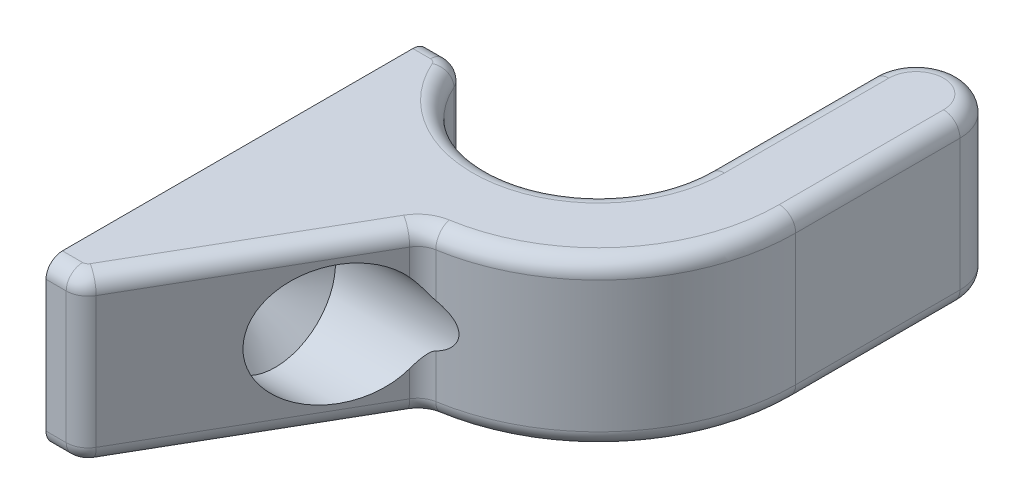
from build123d import *

# Parameters (mm, degrees)
BOSS_EXTRU_1_DEPTH      = 7.5
CONG_1_R                = 2
ESQUISSE2_R             = 2
ENL_V_MAT_EXTRU_1_DEPTH = 3
ESQUISSE3_R             = 5.5
ENL_V_MAT_EXTRU_2_DEPTH = 51.709008317
CHANFREIN1_SIZE2        = 3.5
CHANFREIN1_SIZE         = 2.936848709
CONG_2_R                = 1.5


with BuildPart() as part:
    # Esquisse1 → Boss.-Extru.1 (new, symmetric)
    with BuildSketch(Plane(origin=(0, 0, 0), x_dir=(1, 0, 0), z_dir=(0, 1, 0))):
        with BuildLine():
            Line((3, -15), (0, -15))
            Line((0, -15), (0, 20))
            Line((0, 20), (3, 20))
            ThreePointArc((3, 20), (14.034261007, 12.998776376), (22.572863417, 22.891415916))
            Line((22.572863417, 22.891415916), (22.572863417, 37.891415916))
            ThreePointArc((22.572863417, 37.891415916), (26.572863417, 41.891415916), (30.572863417, 37.891415916))
            Line((30.572863417, 37.891415916), (30.572863417, 22.891415916))
            ThreePointArc((30.572863417, 22.891415916), (25.980595429, 10.881723069), (14.547005384, 5))
            Line((14.547005384, 5), (3, -15))
        make_face()
    extrude(amount=BOSS_EXTRU_1_DEPTH, both=True)

    # Congé1
    cong_1_edges = [part.edges().sort_by_distance(p)[0] for p in [
        (3, 0, -20),
        (14.547005384, 0, -5),
        (3, 0, 15),
    ]]
    fillet(cong_1_edges, radius=CONG_1_R)

    # Esquisse2 → Enlèv. mat.-Extru.1 (cut)
    with BuildSketch(Plane.ZY):
        Circle(ESQUISSE2_R)
    extrude(amount=-ENL_V_MAT_EXTRU_1_DEPTH, mode=Mode.SUBTRACT)

    # Esquisse3 → Enlèv. mat.-Extru.2 (cut, through all)
    with BuildSketch(Plane.ZY.offset(-3)):
        Circle(ESQUISSE3_R)
    extrude(amount=-ENL_V_MAT_EXTRU_2_DEPTH, mode=Mode.SUBTRACT)

    # Chanfrein1
    chanfrein1_edges = [part.edges().sort_by_distance(p)[0] for p in [
        (3, 0, -5.5),
    ]]
    chanfrein1_side = [part.faces().sort_by_distance(p)[0] for p in [
        (3.058736974, 0, -5.5),
    ]]
    chamfer(chanfrein1_edges, length=CHANFREIN1_SIZE - 0.0001, length2=CHANFREIN1_SIZE2 - 0.0001, reference=chanfrein1_side[0])  # a hair under: the kernel refuses the full size

    # Congé2
    cong_2_edges = [part.edges().sort_by_distance(p)[0] for p in [
        (30.572863417, -7.5, -30.391415916),
        (0.922649731, -7.5, 15),
        (30.572863417, 7.5, -30.391415916),
        (26.572863417, 7.5, -41.891415916),
        (22.572863417, 7.5, -30.391415916),
        (14.656699474, 7.5, -13.110944185),
        (0.807516434, -7.5, -20),
        (0.807516434, 7.5, -20),
        (26.286115703, -7.5, -11.231797066),
        (8.81730911, -7.5, 4.924125057),
        (2.845299462, -7.5, 14.732050808),
        (2.703501524, -7.5, -19.677866498),
        (8.81730911, 7.5, 4.924125057),
        (26.286115703, 7.5, -11.231797066),
        (2.845299462, 7.5, 14.732050808),
        (2.703501524, 7.5, -19.677866498),
        (14.652846189, -7.5, -4.797480755),
        (14.652846189, 7.5, -4.797480755),
        (0.922649731, 7.5, 15),
        (14.656699474, -7.5, -13.110944185),
        (22.572863417, -7.5, -30.391415916),
        (26.572863417, -7.5, -41.891415916),
    ]]
    fillet(cong_2_edges, radius=CONG_2_R)


solid = part.part
